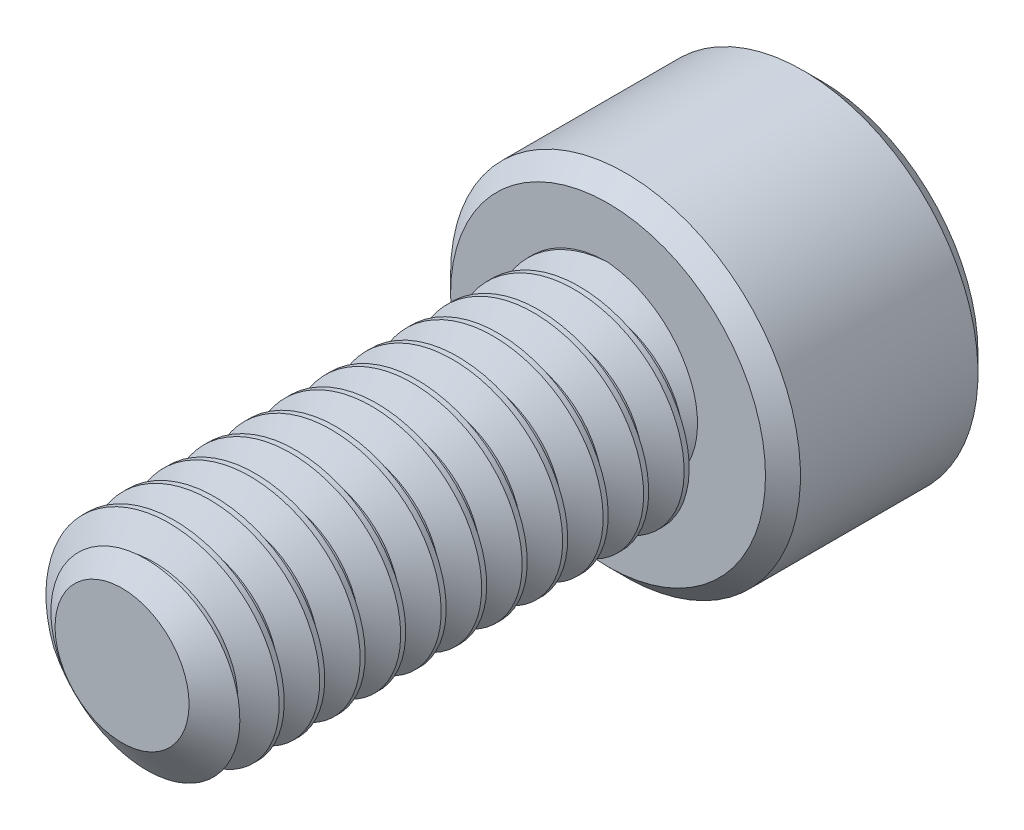
from build123d import *

# Parameters (mm, degrees)
SKETCH1_R          = 2.0828
EXTRUDE1_DEPTH     = 9.525
CUT_SWEEP1_PITCH   = 0.79375
SKETCH6_R          = 3.429
EXTRUDE2_DEPTH     = 4.1656
CUT_EXTRUDE1_DEPTH = 2.67890625
CHAMFER1_SIZE      = 0.3429


with BuildPart() as part:
    # Sketch1 → Extrude1 (new body)
    with BuildSketch(Plane.XY):
        Circle(SKETCH1_R)
    extrude(amount=-EXTRUDE1_DEPTH)

    # Cut-Sweep1: the profile of Sketch3 profile screwed along a right-hand helix of 13 turns, 6 arcs to a turn; built about Z, then put on its axis
    cut_sweep1_z = Axis((0, 0, 0), (0, 0, 1))
    cut_sweep1_corners = [(2.0831, 0, -0.694704455), (1.567244252, 0, -0.396875), (1.567244252, 0, -0.29765625), (2.0831, 0, 0.000173205)]
    with BuildLine(mode=Mode.PRIVATE) as cut_sweep1_profile:
        Line(cut_sweep1_corners[0], cut_sweep1_corners[1])
        Line(cut_sweep1_corners[1], cut_sweep1_corners[2])
        Line(cut_sweep1_corners[2], cut_sweep1_corners[3])
        Line(cut_sweep1_corners[3], cut_sweep1_corners[0])
    cut_sweep1_cap = Face(cut_sweep1_profile.wire())
    cut_sweep1_turn_angles = [0, 30, 60, 90, 120, 150, 180, 210, 240, 270, 300, 330, 360]
    cut_sweep1_turn_weights = [1, 0.8660254037844387, 1, 0.8660254037844387, 1, 0.8660254037844387, 1, 0.8660254037844387, 1, 0.8660254037844387, 1, 0.8660254037844387, 1]
    cut_sweep1_turn_rails = [Edge.make_bspline([Vector(p[0], p[1], 0).rotate(cut_sweep1_z, cut_sweep1_turn_angles[k]) / cut_sweep1_turn_weights[k] + Vector(0, 0, p[2] + CUT_SWEEP1_PITCH * cut_sweep1_turn_angles[k] / 360) for k in range(13)], [0, 0, 0, 1, 1, 2, 2, 3, 3, 4, 4, 5, 5, 6, 6, 6], 2, cut_sweep1_turn_weights) for p in cut_sweep1_corners]
    cut_sweep1_turn_sides = [Face.make_surface_from_curves(cut_sweep1_turn_rails[p[0]], cut_sweep1_turn_rails[p[1]]) for p in [(0, 1), (1, 2), (2, 3), (3, 0)]]
    cut_sweep1 = Plane(origin=(0, 0, 0), x_dir=(0, 1, 0), z_dir=(0, 0, -1)) * Solid(Shell([*[p.moved(Location((0, 0, CUT_SWEEP1_PITCH * i))) for i in range(13) for p in cut_sweep1_turn_sides], cut_sweep1_cap, cut_sweep1_cap.rotate(cut_sweep1_z, 4680).moved(Location((0, 0, CUT_SWEEP1_PITCH * 4680 / 360)))]))
    add(cut_sweep1, mode=Mode.SUBTRACT)

    # Sketch4 → Cut-Revolve1 (revolve, cut)
    with BuildSketch(Plane(origin=(0, 0, 0), x_dir=(0, 0, -1), z_dir=(1, 0, 0)), mode=Mode.PRIVATE) as cut_revolve1_sk:
        Polygon((0.538848736, 2.0828), (0, 1.313244252), (0, 2.0828), align=None)
    revolve(cut_revolve1_sk.sketch.rotate(Axis((0, 0, 0), (0, 0, -1)), 261.048315518), axis=Axis((0, 0, 0), (0, 0, -1)), mode=Mode.SUBTRACT)

    # Sketch6 → Extrude2 (add)
    with BuildSketch(Plane(origin=(0, 0, -9.525), x_dir=(-1, 0, 0), z_dir=(0, 0, -1))):
        Circle(SKETCH6_R)
    extrude(amount=EXTRUDE2_DEPTH)

    # Sketch7 → Cut-Extrude1 (cut)
    with BuildSketch(Plane(origin=(0, 0, -13.6906), x_dir=(-1, 0, 0), z_dir=(0, 0, -1))):
        Polygon((0, 2.062222993), (-1.7859375, 1.031111496), (-1.7859375, -1.031111496), (0, -2.062222993), (1.7859375, -1.031111496), (1.7859375, 1.031111496), align=None)
    extrude(amount=-CUT_EXTRUDE1_DEPTH, mode=Mode.SUBTRACT)

    # Cut-Extrude2 cone 1 section (through the dimple's axis) → Cut-Extrude2 (revolve, cut)
    with BuildSketch(Plane(origin=(0, 0, -13.6906), x_dir=(0, 1, 0), z_dir=(1, 0, 0))):
        Polygon((0, 0), (2.062222993, 0), (0, 2.062222993), align=None)
    revolve(axis=Axis((0, 0, -13.6906), (0, 0, 1)), mode=Mode.SUBTRACT)

    # Chamfer1
    chamfer1_edges = [part.edges().sort_by_distance(p)[0] for p in [
        (3.429, 0, -9.525),
        (3.429, 0, -13.6906),
    ]]
    chamfer(chamfer1_edges, length=CHAMFER1_SIZE)


solid = part.part
